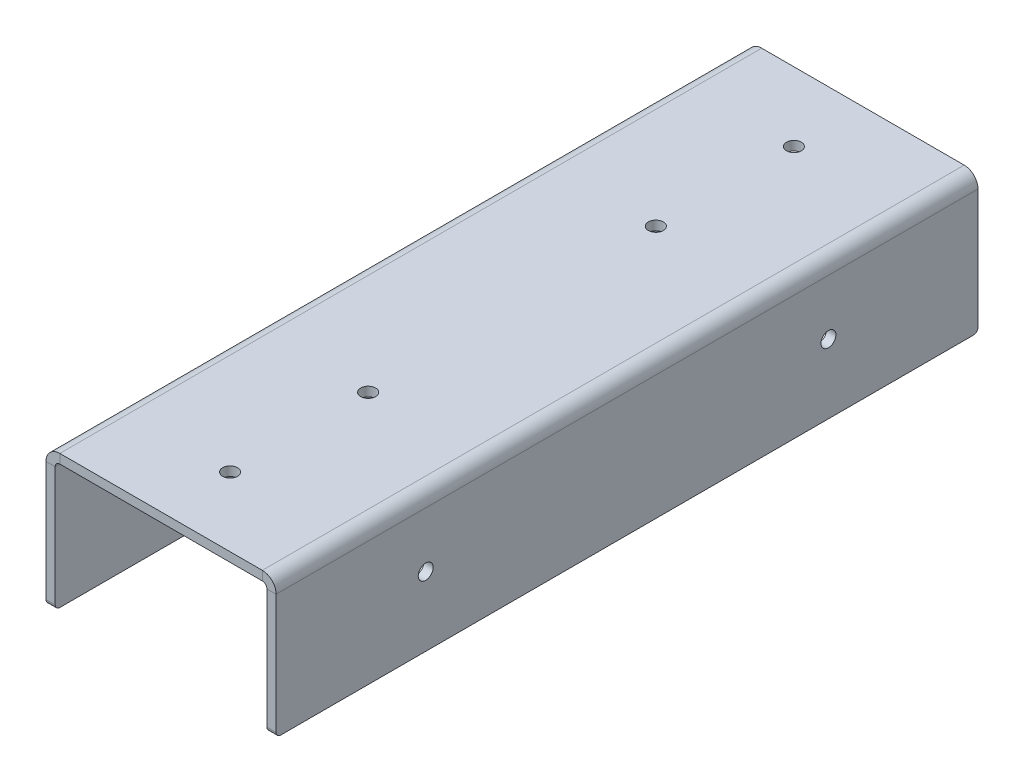
from build123d import *

# Parameters (mm, degrees)
EXTRUDE_THIN1_DEPTH            = 152.5
CONVERT_SOLID1_START           = -152.5
CONVERT_SOLID1_DEPTH           = 305
CONVERT_SOLID1_2_DEPTH         = 305
FILLET1_R                      = 2
F_6_5_6_5_DIAMETER_HOLE1_D     = 6.5
F_6_5_6_5_DIAMETER_HOLE2_D     = 6.5
F_6_5_6_5_DIAMETER_HOLE2_DEPTH = 497


# Read off the part's stored shape, not the designer's step: Convert-Solid1
with BuildPart() as part:
    # Sketch1 → Extrude-Thin1 (new, symmetric)
    with BuildSketch(Plane.XY):
        Polygon((-50, -60), (-50, 0), (50, 0), (50, -60), (46, -60), (46, -4), (-46, -4), (-46, -60), align=None)
    extrude(amount=EXTRUDE_THIN1_DEPTH, both=True)

    # Convert-Solid1 outline → Convert-Solid1 (cut)
    with BuildSketch(Plane.XY.offset(CONVERT_SOLID1_START)):
        with BuildLine():
            Line((50, 0), (44, 0))
            ThreePointArc((44, 0), (48.242640687, -1.757359313), (50, -6))
            Line((50, -6), (50, 0))
        make_face()
        with BuildLine():
            ThreePointArc((-50, -6), (-48.242640687, -1.757359313), (-44, 0))
            Line((-44, 0), (-50, 0))
            Line((-50, 0), (-50, -6))
        make_face()
    extrude(amount=CONVERT_SOLID1_DEPTH, mode=Mode.SUBTRACT)

    # Convert-Solid1 2 outline → Convert-Solid1 2 (add)
    with BuildSketch(Plane.XY.offset(CONVERT_SOLID1_START)):
        with BuildLine():
            Line((46, -4), (44, -4))
            ThreePointArc((44, -4), (45.414213562, -4.585786438), (46, -6))
            Line((46, -6), (46, -4))
        make_face()
        with BuildLine():
            ThreePointArc((-46, -6), (-45.414213562, -4.585786438), (-44, -4))
            Line((-44, -4), (-46, -4))
            Line((-46, -4), (-46, -6))
        make_face()
    extrude(amount=CONVERT_SOLID1_2_DEPTH)

    # Fillet1
    fillet1_edges = [part.edges().sort_by_distance(p)[0] for p in [
        (48, -60, 152.5),
        (48, -60, -152.5),
        (-48, -60, -152.5),
        (-48, -60, 152.5),
    ]]
    fillet(fillet1_edges, radius=FILLET1_R)

    # Ø6.5 (6.5) Diameter Hole1 (through all)
    with Locations(Plane(origin=(-244.5, 0, 0), x_dir=(0, 0, 1), z_dir=(0, 1, 0))):
        with Locations((-122.5, 244.5), (-62.5, 244.5), (62.5, 244.5), (122.5, 244.5)):
            Hole(F_6_5_6_5_DIAMETER_HOLE1_D / 2)

    # Ø6.5 (6.5) Diameter Hole2
    with Locations(Plane(origin=(-447, -38, 0), x_dir=(0, 0, 1), z_dir=(-1, 0, 0))):
        with Locations((-87.5, 8), (87.5, 8)):
            Hole(F_6_5_6_5_DIAMETER_HOLE2_D / 2, depth=F_6_5_6_5_DIAMETER_HOLE2_DEPTH)


solid = part.part
